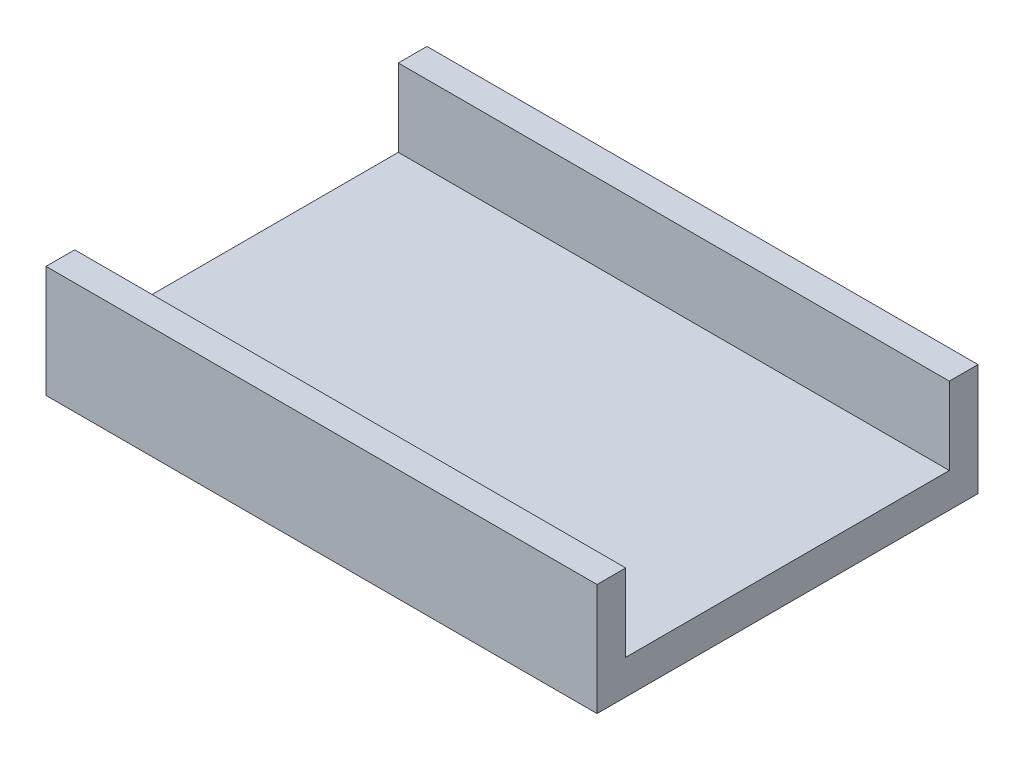
from build123d import *

# Parameters (mm, degrees)
SKETCH1_W           = 97.6
SKETCH1_H           = 66.43745389
BOSS_EXTRUDE1_DEPTH = 6
SKETCH4_W           = 97.6
SKETCH4_H           = 66.43745389
SKETCH4_W_2         = 55
SKETCH4_H_2         = 54
BOSS_EXTRUDE2_DEPTH = 13.5
SKETCH6_W           = 97.6
SKETCH6_H           = 56.43745389
CUT_EXTRUDE2_DEPTH  = 13.5
SKETCH7_W           = 66.43745389
SKETCH7_H           = 19.5
CUT_EXTRUDE3_DEPTH  = 0.75
SKETCH8_W           = 66.43745389
SKETCH8_H           = 19.5
CUT_EXTRUDE4_DEPTH  = 0.75


with BuildPart() as part:
    # Sketch1 → Boss-Extrude1 (new body)
    with BuildSketch(Plane(origin=(0, 0, 0), x_dir=(1, 0, 0), z_dir=(0, 1, 0))):
        Rectangle(SKETCH1_W, SKETCH1_H)
    extrude(amount=BOSS_EXTRUDE1_DEPTH)

    # Sketch4 → Boss-Extrude2 (add)
    with BuildSketch(Plane(origin=(0, 6, 0), x_dir=(1, 0, 0), z_dir=(0, 1, 0))):
        Rectangle(SKETCH4_W, SKETCH4_H)
        with Locations((3.3, 0)):
            Rectangle(SKETCH4_W_2, SKETCH4_H_2, mode=Mode.SUBTRACT)
    extrude(amount=BOSS_EXTRUDE2_DEPTH)

    # Sketch6 → Cut-Extrude2 (cut)
    with BuildSketch(Plane(origin=(0, 19.5, 0), x_dir=(1, 0, 0), z_dir=(0, 1, 0))):
        Rectangle(SKETCH6_W, SKETCH6_H)
    extrude(amount=-CUT_EXTRUDE2_DEPTH, mode=Mode.SUBTRACT)

    # Sketch7 → Cut-Extrude3 (cut)
    with BuildSketch(Plane(origin=(48.8, 0, 0), x_dir=(0, 0, -1), z_dir=(1, 0, 0))):
        with Locations((0, 9.75)):
            Rectangle(SKETCH7_W, SKETCH7_H)
    extrude(amount=-CUT_EXTRUDE3_DEPTH, mode=Mode.SUBTRACT)

    # Sketch8 → Cut-Extrude4 (cut)
    with BuildSketch(Plane.ZY.offset(48.8)):
        with Locations((0, 9.75)):
            Rectangle(SKETCH8_W, SKETCH8_H)
    extrude(amount=-CUT_EXTRUDE4_DEPTH, mode=Mode.SUBTRACT)


solid = part.part
